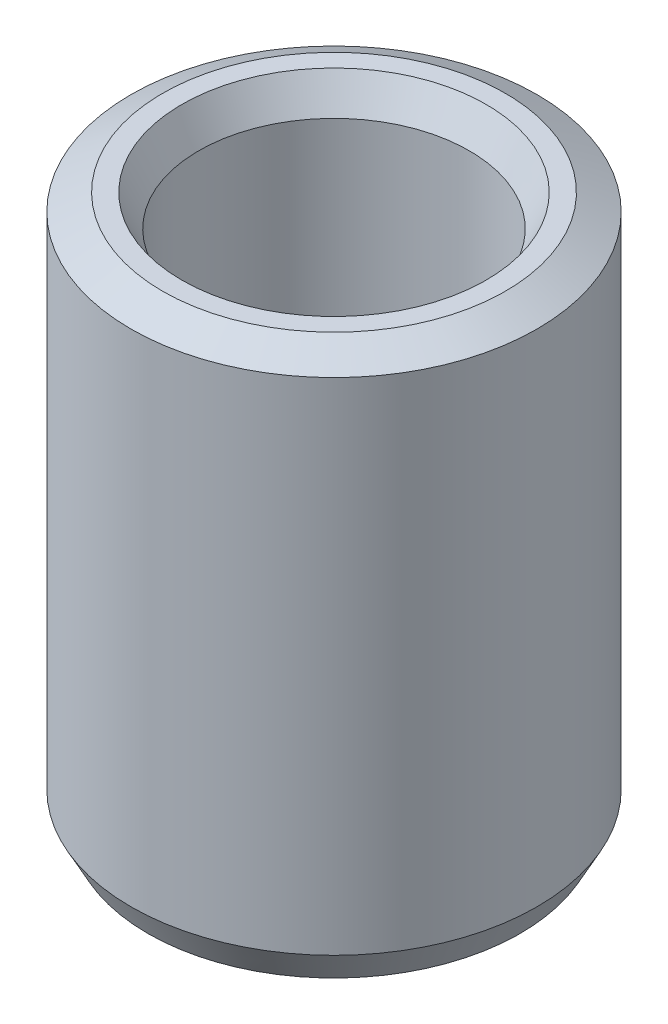
from build123d import *
from OCP.BRepFilletAPI import BRepFilletAPI_MakeChamfer

# Parameters (mm, degrees)
SKETCH1_R           = 47.5
BOSS_EXTRUDE1_DEPTH = 128.3973652
SKETCH2_R           = 31.64427417
CUT_EXTRUDE1_DEPTH  = 145.908189521
CHAMFER1_SIZE       = 3.957522894
CHAMFER1_SIZE2      = 7.398904549


with BuildPart() as part:
    # Sketch1 → Boss-Extrude1 (new body)
    with BuildSketch(Plane(origin=(0, 0, 0), x_dir=(1, 0, 0), z_dir=(0, 1, 0))):
        Circle(SKETCH1_R)
    extrude(amount=BOSS_EXTRUDE1_DEPTH)

    # Sketch2 → Cut-Extrude1 (cut, through all)
    with BuildSketch(Plane(origin=(0, 0, 0), x_dir=(1, 0, 0), z_dir=(0, 1, 0))):
        Circle(SKETCH2_R)
    extrude(amount=CUT_EXTRUDE1_DEPTH, mode=Mode.SUBTRACT)

    # Chamfer1: one chamfer whose edges measure the first distance from different faces: ONE call of the kernel's chamfer builder (chamfer() names one face for all edges)
    chamfer1_edges_1 = [part.edges().sort_by_distance(p)[0] for p in [
        (-31.64427417, 128.3973652, 0),
    ]]
    chamfer1_side_1 = [part.faces().sort_by_distance(p)[0] for p in [
        (-46.156497116, 128.3973652, 0),
    ]]
    chamfer1_edges_2 = [part.edges().sort_by_distance(p)[0] for p in [
        (-31.64427417, 0, 0),
    ]]
    chamfer1_side_2 = [part.faces().sort_by_distance(p)[0] for p in [
        (-31.64427417, 64.1986826, 0),
    ]]
    chamfer1_edges_3 = [part.edges().sort_by_distance(p)[0] for p in [
        (-47.5, 0, 0),
    ]]
    chamfer1_side_3 = [part.faces().sort_by_distance(p)[0] for p in [
        (-46.156497116, 0, 0),
    ]]
    chamfer1_edges_4 = [part.edges().sort_by_distance(p)[0] for p in [
        (-47.5, 128.3973652, 0),
    ]]
    chamfer1_side_4 = [part.faces().sort_by_distance(p)[0] for p in [
        (-47.5, 64.1986826, 0),
    ]]
    chamfer1 = BRepFilletAPI_MakeChamfer(part.part.solid().wrapped)
    for e in chamfer1_edges_1:
        chamfer1.Add(CHAMFER1_SIZE, CHAMFER1_SIZE2, e.wrapped, chamfer1_side_1[0].wrapped)  # the first distance lies on this face
    for e in chamfer1_edges_2:
        chamfer1.Add(CHAMFER1_SIZE, CHAMFER1_SIZE2, e.wrapped, chamfer1_side_2[0].wrapped)  # the first distance lies on this face
    for e in chamfer1_edges_3:
        chamfer1.Add(CHAMFER1_SIZE, CHAMFER1_SIZE2, e.wrapped, chamfer1_side_3[0].wrapped)  # the first distance lies on this face
    for e in chamfer1_edges_4:
        chamfer1.Add(CHAMFER1_SIZE, CHAMFER1_SIZE2, e.wrapped, chamfer1_side_4[0].wrapped)  # the first distance lies on this face
    add(Compound.cast(chamfer1.Shape()), mode=Mode.REPLACE)


solid = part.part
